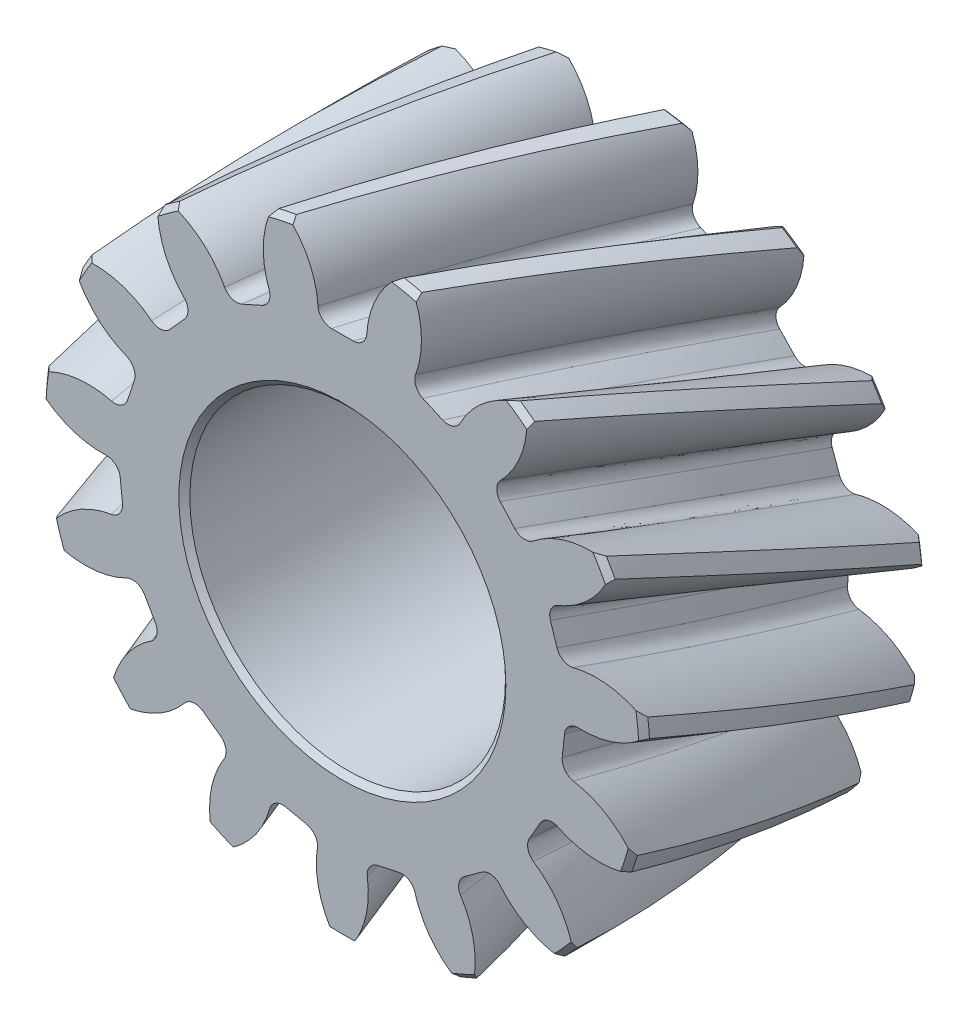
from build123d import *
from OCP.BRepFilletAPI import BRepFilletAPI_MakeChamfer

# Parameters (mm, degrees)
SKETCH2_R           = 10.625
BOSS_EXTRUDE1_DEPTH = 10
M6_TAPPED_HOLE1_D   = 11.1
CHAMFER2_SIZE       = 0.2
CHAMFER2_SIZE2      = 0.186503017
CUT_SWEEP1_PITCH    = 161.84
CIRPATTERN1_COUNT   = 15


with BuildPart() as part:
    # Sketch2 → Boss-Extrude1 (new body)
    with BuildSketch(Plane.XY):
        Circle(SKETCH2_R)
    extrude(amount=BOSS_EXTRUDE1_DEPTH)

    # M6 Tapped Hole1 (through all)
    with Locations(Plane.XY.offset(10)):
        with Locations((0, 0)):
            Hole(M6_TAPPED_HOLE1_D / 2)

    # Chamfer2: one chamfer whose edges measure the first distance from different faces: ONE call of the kernel's chamfer builder (chamfer() names one face for all edges)
    chamfer2_edges_1 = [part.edges().sort_by_distance(p)[0] for p in [
        (-10.625, 0, 0),
    ]]
    chamfer2_side_1 = [part.faces().sort_by_distance(p)[0] for p in [
        (-10.324479618, 0, 0),
    ]]
    chamfer2_edges_2 = [part.edges().sort_by_distance(p)[0] for p in [
        (-10.625, 0, 10),
    ]]
    chamfer2_side_2 = [part.faces().sort_by_distance(p)[0] for p in [
        (-10.625, 0, 5),
    ]]
    chamfer2_edges_3 = [part.edges().sort_by_distance(p)[0] for p in [
        (5.55, 0, 10),
    ]]
    chamfer2_side_3 = [part.faces().sort_by_distance(p)[0] for p in [
        (-10.324479618, 0, 10),
    ]]
    chamfer2_edges_4 = [part.edges().sort_by_distance(p)[0] for p in [
        (5.55, 0, 0),
    ]]
    chamfer2_side_4 = [part.faces().sort_by_distance(p)[0] for p in [
        (5.55, 0, 5),
    ]]
    chamfer2 = BRepFilletAPI_MakeChamfer(part.part.solid().wrapped)
    for e in chamfer2_edges_1:
        chamfer2.Add(CHAMFER2_SIZE, CHAMFER2_SIZE2, e.wrapped, chamfer2_side_1[0].wrapped)  # the first distance lies on this face
    for e in chamfer2_edges_2:
        chamfer2.Add(CHAMFER2_SIZE, CHAMFER2_SIZE2, e.wrapped, chamfer2_side_2[0].wrapped)  # the first distance lies on this face
    for e in chamfer2_edges_3:
        chamfer2.Add(CHAMFER2_SIZE, CHAMFER2_SIZE2, e.wrapped, chamfer2_side_3[0].wrapped)  # the first distance lies on this face
    for e in chamfer2_edges_4:
        chamfer2.Add(CHAMFER2_SIZE, CHAMFER2_SIZE2, e.wrapped, chamfer2_side_4[0].wrapped)  # the first distance lies on this face
    add(Compound.cast(chamfer2.Shape()), mode=Mode.REPLACE)

    # Cut-Sweep1: the profile of Sketch8 screwed along a right-hand helix of 0.061789 turns, 40 arcs to a turn; built about Z, then put on its axis
    cut_sweep1_z = Axis((0, 0, 0), (0, 0, 1))
    cut_sweep1_corners = [(7.815, -0.38, 0), (7.815, 0.38, 0), (8.25373737, 0.858223165, 0), (10.45373737, 1.9, 0), (10.45373737, -1.9, 0), (8.25373737, -0.858223165, 0)]
    with BuildLine(mode=Mode.PRIVATE) as cut_sweep1_profile:
        Line(cut_sweep1_corners[0], cut_sweep1_corners[1])
        ThreePointArc((7.815, 0.38, 0), (7.941300931, 0.704494944, 0), (8.25373737, 0.858223165, 0))
        ThreePointArc((8.25373737, 0.858223165, 0), (9.454954225, 1.165364191, 0), (10.45373737, 1.9, 0))
        ThreePointArc((10.45373737, 1.9, 0), (10.625, 0, 0), (10.45373737, -1.9, 0))
        ThreePointArc((10.45373737, -1.9, 0), (9.454954225, -1.165364191, 0), (8.25373737, -0.858223165, 0))
        ThreePointArc((8.25373737, -0.858223165, 0), (7.941300931, -0.704494944, 0), (7.815, -0.38, 0))
    cut_sweep1_cap = Face(cut_sweep1_profile.wire())
    cut_sweep1_arcs = [((7.815, 0.38, 0), (7.815, 0.820367496, 0), (8.25373737, 0.858223165, 0), (1, 0.7368730598254759, 1)), ((8.25373737, 0.858223165, 0), (9.564114638, 0.934841779, 0), (10.45373737, 1.9, 0), (1, 0.9272304121920343, 1)), ((10.45373737, 1.9, 0), (10.79906841, 0, 0), (10.45373737, -1.9, 0), (1, 0.9838811642310873, 1)), ((10.45373737, -1.9, 0), (9.564114638, -0.934841779, 0), (8.25373737, -0.858223165, 0), (1, 0.9272304121920337, 1)), ((8.25373737, -0.858223165, 0), (7.815, -0.820367496, 0), (7.815, -0.38, 0), (1, 0.7368730598254759, 1))]  # start, shoulder, end, weights
    cut_sweep1_turn_angles = [0, 4.5, 9, 13.5, 18, 20.122095897, 22.244191794]
    cut_sweep1_turn_weights = [1, 0.996917333733128, 1, 0.996917333733128, 1, 0.9993141879620284, 1]
    cut_sweep1_turn_rails = [Edge.make_bspline([Vector(p[0], p[1], 0).rotate(cut_sweep1_z, cut_sweep1_turn_angles[k]) / cut_sweep1_turn_weights[k] + Vector(0, 0, p[2] + CUT_SWEEP1_PITCH * cut_sweep1_turn_angles[k] / 360) for k in range(7)], [0, 0, 0, 1, 1, 2, 2, 3, 3, 3], 2, cut_sweep1_turn_weights) for p in cut_sweep1_corners]
    cut_sweep1_turn_sides = [*[Face.make_surface_from_curves(cut_sweep1_turn_rails[p[0]], cut_sweep1_turn_rails[p[1]]) for p in [(0, 1)]], *[Face.make_bezier_surface([[Vector(p[j][0], p[j][1], 0).rotate(cut_sweep1_z, cut_sweep1_turn_angles[2 * i + k]) / cut_sweep1_turn_weights[2 * i + k] + Vector(0, 0, p[j][2] + CUT_SWEEP1_PITCH * cut_sweep1_turn_angles[2 * i + k] / 360) for k in range(3)] for j in range(3)], [[p[3][j] * cut_sweep1_turn_weights[2 * i + k] for k in range(3)] for j in range(3)]) for p in cut_sweep1_arcs for i in range(3)]]
    cut_sweep1 = Plane(origin=(0, 0, 10), x_dir=(0, 1, 0), z_dir=(0, 0, -1)) * Solid(Shell([*cut_sweep1_turn_sides, cut_sweep1_cap, cut_sweep1_cap.rotate(cut_sweep1_z, 22.244191794).moved(Location((0, 0, CUT_SWEEP1_PITCH * 22.244191794 / 360)))]))
    add(cut_sweep1, mode=Mode.SUBTRACT)

    # CirPattern1: Cut-Sweep1 ×15 about axis
    cirpattern1_axis = Axis((0, 0, 10), (0, 0, 1))
    for i in range(1, CIRPATTERN1_COUNT):
        add(cut_sweep1.rotate(cirpattern1_axis, i * 360 / CIRPATTERN1_COUNT), mode=Mode.SUBTRACT)


solid = part.part
